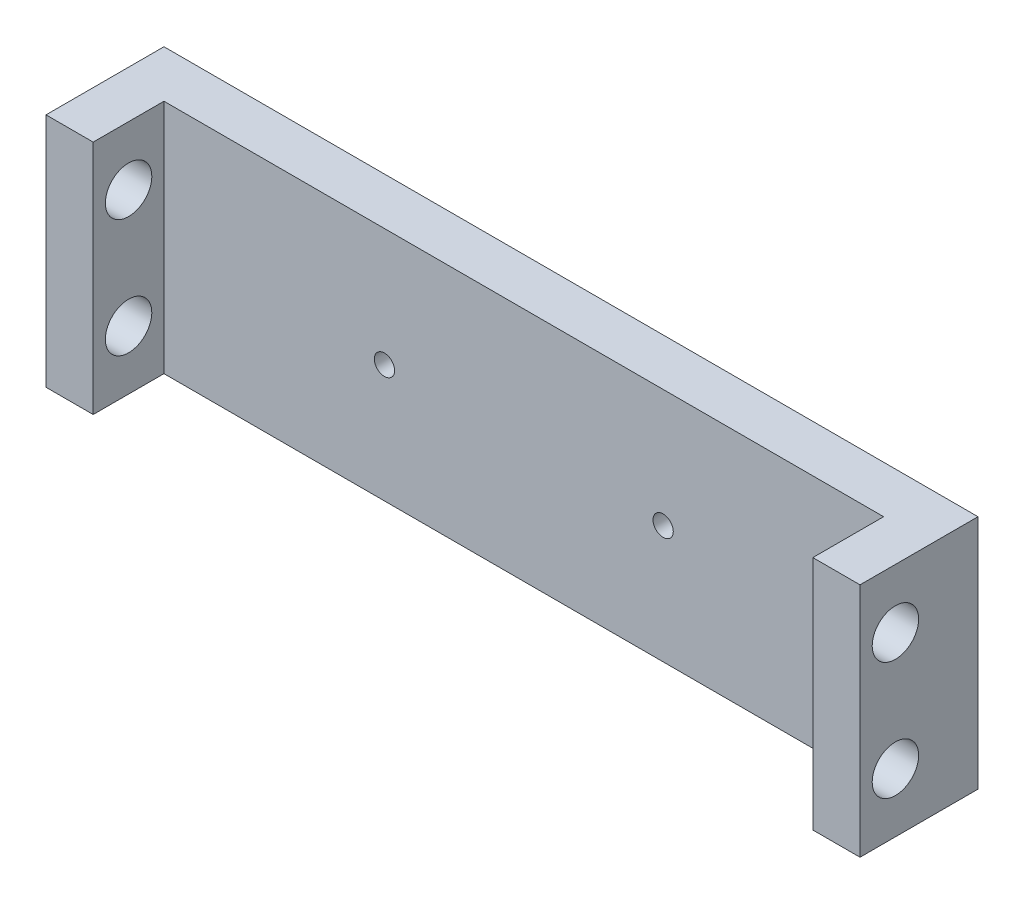
from build123d import *

# Parameters (mm, degrees)
SKETCH1_W               = 77.47
SKETCH1_H               = 25.4
SKETCH1_R               = 1.0922
BOSS_EXTRUDE1_DEPTH     = 5.08
SKETCH1_3_W             = 5.08
SKETCH1_3_H             = 25.4
BOSS_EXTRUDE2_DEPTH     = 12.7
CUT_EXTRUDE1_DEPTH      = 88.298066989
CUT_EXTRUDE1_DEPTH_BACK = 88.298066989
SKETCH2_R               = 2.5


with BuildPart() as part:
    # Sketch1 → Boss-Extrude1 (new body)
    with BuildSketch(Plane.XY):
        with Locations((43.815, 12.7)):
            Rectangle(SKETCH1_W, SKETCH1_H)
        with Locations((58.815, 12.7)):
            Circle(SKETCH1_R, mode=Mode.SUBTRACT)
        with Locations((28.815, 12.7)):
            Circle(SKETCH1_R, mode=Mode.SUBTRACT)
    extrude(amount=BOSS_EXTRUDE1_DEPTH)

    # Sketch1<3> → Boss-Extrude2 (add)
    with BuildSketch(Plane.XY):
        with Locations((85.09, 12.7)):
            Rectangle(SKETCH1_3_W, SKETCH1_3_H)
        with Locations((2.54, 12.7)):
            Rectangle(SKETCH1_3_W, SKETCH1_3_H)
    extrude(amount=BOSS_EXTRUDE2_DEPTH)

    # Sketch2 → Cut-Extrude1 (cut, two sides: drawn at the far end of the back side and taken through both)
    with BuildSketch(Plane.ZY.offset(-82.55).offset(-CUT_EXTRUDE1_DEPTH_BACK)):
        with Locations((8.89, 19.05)):
            Circle(SKETCH2_R)
        with Locations((8.89, 6.35)):
            Circle(SKETCH2_R)
    extrude(amount=CUT_EXTRUDE1_DEPTH + CUT_EXTRUDE1_DEPTH_BACK, mode=Mode.SUBTRACT)


solid = part.part
